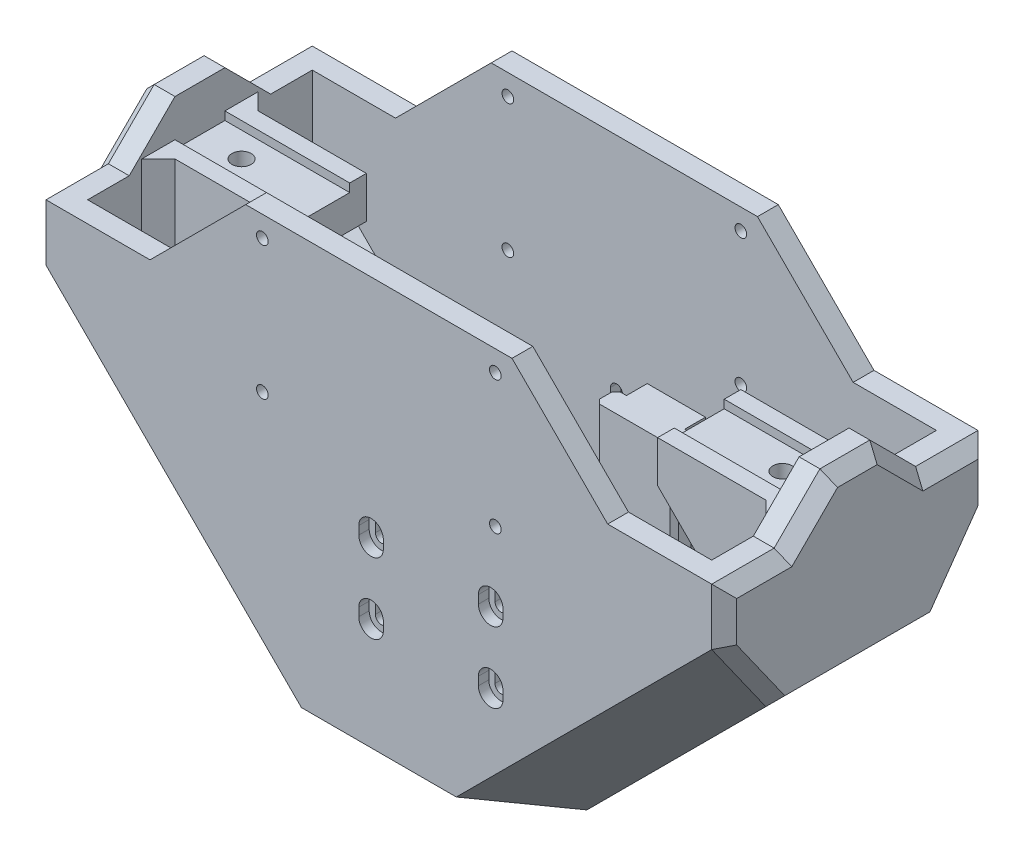
from build123d import *

# Parameters (mm, degrees)
SKETCH1_W                  = 150
SKETCH1_H                  = 54
BOSS_EXTRUDE1_DEPTH        = 70
SHELL1_T                   = 5
BOSS_EXTRUDE2_DEPTH        = 5
BOSS_EXTRUDE3_DEPTH        = 5
SKETCH3_R                  = 1.4
CUT_EXTRUDE1_DEPTH         = 6
BOSS_EXTRUDE4_DEPTH        = 10
SKETCH9_W                  = 30
SKETCH9_H                  = 20
BOSS_EXTRUDE6_DEPTH        = 2
CUT_EXTRUDE2_REACH         = 185.57
SKETCH10_W                 = 12
SKETCH10_H                 = 2
SKETCH11_R                 = 2.3
CUT_EXTRUDE3_DEPTH         = 6
CHAMFER3_SIZE              = 40
CHAMFER5_SIZE              = 43
CHAMFER11_SIZE             = 10
CHAMFER12_SIZE             = 13
CHAMFER13_SIZE             = 4
BOSS_EXTRUDE10_DEPTH       = 3
CHAMFER14_SIZE             = 3
CHAMFER14_OF_MIRROR28_SIZE = 3
SKETCH17_W                 = 14
SKETCH17_H                 = 5
BOSS_EXTRUDE11_DEPTH       = 45
SKETCH20_W                 = 19
SKETCH20_H                 = 5
BOSS_EXTRUDE14_DEPTH       = 8
CUT_EXTRUDE4_DEPTH         = 2.5
CUT_EXTRUDE5_REACH         = 140.997
CUT_EXTRUDE6_REACH         = 154.756
SKETCH24_W                 = 15
SKETCH24_H                 = 8
CHAMFER18_SIZE             = 4
CHAMFER19_SIZE             = 1
CHAMFER20_SIZE             = 2


# Some blends are built 0.0001 mm under size
with BuildPart() as part:
    # Sketch1 → Boss-Extrude1 (new body)
    with BuildSketch(Plane(origin=(0, 0, 0), x_dir=(1, 0, 0), z_dir=(0, 1, 0))):
        Rectangle(SKETCH1_W, SKETCH1_H)
    extrude(amount=BOSS_EXTRUDE1_DEPTH)

    # Shell1
    shell1_openings = [part.faces().sort_by_distance(p)[0] for p in [
        (0, 70, 0),
    ]]
    offset(amount=SHELL1_T, openings=shell1_openings, kind=Kind.INTERSECTION)

    # Sketch2 → Boss-Extrude2 (add)
    with BuildSketch(Plane(origin=(80, 0, 0), x_dir=(0, 0, -1), z_dir=(1, 0, 0))):
        Polygon((-17, 70), (-6, 81), (6, 81), (17, 70), align=None)
    boss_extrude2 = extrude(amount=-BOSS_EXTRUDE2_DEPTH)

    # Sketch4 → Boss-Extrude3 (add)
    with BuildSketch(Plane(origin=(0, 0, -32), x_dir=(-1, 0, 0), z_dir=(0, 0, -1))):
        Polygon((-55, 70), (-32, 93), (32, 93), (55, 70), align=None)
    boss_extrude3 = extrude(amount=-BOSS_EXTRUDE3_DEPTH)

    # Sketch3 → Cut-Extrude1 (cut)
    with BuildSketch(Plane(origin=(0, 0, -32), x_dir=(-1, 0, 0), z_dir=(0, 0, -1))):
        with Locations((-28, 88)):
            Circle(SKETCH3_R)
        with Locations((-28, 56)):
            Circle(SKETCH3_R)
        with Locations((28, 88)):
            Circle(SKETCH3_R)
        with Locations((28, 56)):
            Circle(SKETCH3_R)
    cut_extrude1 = extrude(amount=-CUT_EXTRUDE1_DEPTH, mode=Mode.SUBTRACT)

    # Mirror4: Boss-Extrude3, Cut-Extrude1 across plane
    add(boss_extrude3.mirror(Plane.XY))
    add(cut_extrude1.mirror(Plane.XY), mode=Mode.SUBTRACT)

    # Mirror5: Boss-Extrude2 across plane
    add(boss_extrude2.mirror(Plane(origin=(0, 0, 0), x_dir=(0, 0, 1), z_dir=(1, 0, 0))))

    # Sketch5 → Boss-Extrude4 (add, symmetric)
    with BuildSketch(Plane.XY):
        Polygon((-75, 70), (-45, 70), (-45, 62), (-75, 32), align=None)
    boss_extrude4 = extrude(amount=BOSS_EXTRUDE4_DEPTH, both=True)

    # Sketch9 → Boss-Extrude6 (add)
    with BuildSketch(Plane(origin=(0, 70, 0), x_dir=(1, 0, 0), z_dir=(0, 1, 0))):
        with Locations((-60, 0)):
            Rectangle(SKETCH9_W, SKETCH9_H)
    boss_extrude6 = extrude(amount=BOSS_EXTRUDE6_DEPTH)

    # Sketch10 → Cut-Extrude2 (cut, up to next)
    with BuildSketch(Plane(origin=(-75, 0, 0), x_dir=(0, 0, -1), z_dir=(1, 0, 0)), mode=Mode.PRIVATE) as cut_extrude2_sk1:
        with Locations((0, 71)):
            Rectangle(SKETCH10_W, SKETCH10_H)
    cut_extrude2_tool1 = extrude(cut_extrude2_sk1.sketch, amount=CUT_EXTRUDE2_REACH, mode=Mode.PRIVATE) & part.part
    cut_extrude2 = cut_extrude2_tool1.solids().sort_by_distance((-75, 71, 0))[0]
    add(cut_extrude2, mode=Mode.SUBTRACT)

    # Sketch11 → Cut-Extrude3 (cut)
    with BuildSketch(Plane(origin=(0, 70, 0), x_dir=(1, 0, 0), z_dir=(0, 1, 0))):
        with Locations(Location((-65, 0, 0), (0, 0, 270))):
            Circle(SKETCH11_R)
    cut_extrude3 = extrude(amount=-CUT_EXTRUDE3_DEPTH, mode=Mode.SUBTRACT)

    # Mirror24: Boss-Extrude4, Boss-Extrude6, Cut-Extrude2, Cut-Extrude3 across plane
    add(boss_extrude4.mirror(Plane(origin=(0, 0, 0), x_dir=(0, 0, 1), z_dir=(1, 0, 0))))
    add(boss_extrude6.mirror(Plane(origin=(0, 0, 0), x_dir=(0, 0, 1), z_dir=(1, 0, 0))))
    add(cut_extrude2.mirror(Plane(origin=(0, 0, 0), x_dir=(0, 0, 1), z_dir=(1, 0, 0))), mode=Mode.SUBTRACT)
    add(cut_extrude3.mirror(Plane(origin=(0, 0, 0), x_dir=(0, 0, 1), z_dir=(1, 0, 0))), mode=Mode.SUBTRACT)

    # Chamfer3
    # the kernel refuses this chamfer: 40 mm, written as the material it adds along each edge
    with BuildSketch(Plane(origin=(75, 0, 27), x_dir=(-0.9996219169112968, -0.027495876610586372, 0), z_dir=(0, 0, -1))) as chamfer3_piece_1:
        Polygon((CHAMFER3_SIZE * 0.999621916911, CHAMFER3_SIZE * 0.0274958766106), (-CHAMFER3_SIZE * 0.0274958766106, CHAMFER3_SIZE * 0.999621916911), (0, 0), align=None)
    extrude(amount=54)
    with BuildSketch(Plane(origin=(-75, 0, -27), x_dir=(-0.027495876610586317, 0.9996219169112968, 0), z_dir=(0, 0, 1))) as chamfer3_piece_2:
        Polygon((CHAMFER3_SIZE * 0.999621916911, -CHAMFER3_SIZE * 0.0274958766106), (-CHAMFER3_SIZE * 0.0274958766106, -CHAMFER3_SIZE * 0.999621916911), (0, 0), align=None)
    extrude(amount=54)

    # Chamfer5
    chamfer5_edges = [part.edges().sort_by_distance(p)[0] for p in [
        (-80, -5, 0),
        (80, -5, 0),
    ]]
    chamfer(chamfer5_edges, length=CHAMFER5_SIZE)

    # Chamfer11
    chamfer11_edges = [part.edges().sort_by_distance(p)[0] for p in [
        (-55, 20, -27),
        (55, 20, -27),
        (-55, 20, 27),
        (55, 20, 27),
    ]]
    chamfer(chamfer11_edges, length=CHAMFER11_SIZE)

    # Chamfer12
    chamfer12_edges = [part.edges().sort_by_distance(p)[0] for p in [
        (-58.5, 16.5, -32),
        (58.5, 16.5, -32),
        (-58.5, 16.5, 32),
        (58.5, 16.5, 32),
    ]]
    chamfer(chamfer12_edges, length=CHAMFER12_SIZE)

    # Chamfer13
    chamfer13_edges = [part.edges().sort_by_distance(p)[0] for p in [
        (-75, 56, -10),
        (-75, 56, 10),
        (75, 56, 10),
        (75, 56, -10),
    ]]
    chamfer(chamfer13_edges, length=CHAMFER13_SIZE)

    # Sketch16 → Boss-Extrude10 (add)
    with BuildSketch(Plane(origin=(80, 0, 0), x_dir=(0, 0, -1), z_dir=(1, 0, 0))):
        Polygon((-19, 38), (19, 38), (32, 56.384776311), (32, 70), (17, 70), (6, 81), (-6, 81), (-17, 70), (-32, 70), (-32, 56.384776311), align=None)
    boss_extrude10 = extrude(amount=BOSS_EXTRUDE10_DEPTH)

    # Chamfer14
    chamfer14_edges = [part.edges().sort_by_distance(p)[0] for p in [
        (83, 63.192388155, 32),
        (83, 70, 24.5),
        (83, 75.5, 11.5),
        (83, 81, 0),
        (83, 75.5, -11.5),
        (83, 70, -24.5),
        (83, 63.192388155, -32),
        (83, 47.192388155, -25.5),
        (83, 38, 0),
        (83, 47.192388155, 25.5),
    ]]
    chamfer(chamfer14_edges, length=CHAMFER14_SIZE - 0.0001)  # a hair under: the kernel refuses the full size

    # Mirror28: Boss-Extrude10 across plane
    add(boss_extrude10.mirror(Plane(origin=(0, 0, 0), x_dir=(0, 0, 1), z_dir=(1, 0, 0))))

    # Chamfer14 of Mirror28
    chamfer14_of_mirror28_edges = [part.edges().sort_by_distance(p)[0] for p in [
        (-83, 63.192388155, 32),
        (-83, 70, 24.5),
        (-83, 75.5, 11.5),
        (-83, 81, 0),
        (-83, 75.5, -11.5),
        (-83, 70, -24.5),
        (-83, 63.192388155, -32),
        (-83, 47.192388155, -25.5),
        (-83, 38, 0),
        (-83, 47.192388155, 25.5),
    ]]
    chamfer(chamfer14_of_mirror28_edges, length=CHAMFER14_OF_MIRROR28_SIZE - 0.0001)  # a hair under: the kernel refuses the full size

    # Sketch17 → Boss-Extrude11 (add)
    with BuildSketch(Plane(origin=(0, 0, 0), x_dir=(1, 0, 0), z_dir=(0, 1, 0))):
        Polygon((3, -22), (5.5, -22), (19.5, -22), (22, -22), (22, -17), (3, -17), align=None)
        with Locations((12.5, -24.5)):
            Rectangle(SKETCH17_W, SKETCH17_H)
    boss_extrude11 = extrude(amount=BOSS_EXTRUDE11_DEPTH)

    # Sketch20 → Boss-Extrude14 (add)
    with BuildSketch(Plane(origin=(0, 0, 0), x_dir=(1, 0, 0), z_dir=(0, 1, 0))):
        with Locations((12.5, -14.5)):
            Rectangle(SKETCH20_W, SKETCH20_H)
    boss_extrude14 = extrude(amount=BOSS_EXTRUDE14_DEPTH)

    # Mirror29: Boss-Extrude11, Boss-Extrude14 across plane
    add(boss_extrude11.mirror(Plane.XY))
    add(boss_extrude14.mirror(Plane.XY))

    # Sketch22 → Cut-Extrude4 (cut)
    with BuildSketch(Plane.XY.offset(-27)):
        with BuildLine():
            Line((-3.325, 37.8), (-3.325, 39.8))
            ThreePointArc((-3.325, 39.8), (-1.875, 41.25), (-0.425, 39.8))
            Line((-0.425, 39.8), (-0.425, 37.8))
            ThreePointArc((-0.425, 37.8), (-1.875, 36.35), (-3.325, 37.8))
        make_face()
        with BuildLine():
            Line((28.325, 37.8), (28.325, 39.8))
            ThreePointArc((28.325, 39.8), (26.875, 41.25), (25.425, 39.8))
            Line((25.425, 39.8), (25.425, 37.8))
            ThreePointArc((25.425, 37.8), (26.875, 36.35), (28.325, 37.8))
        make_face()
        with BuildLine():
            Line((-3.325, 22.8), (-3.325, 20.8))
            ThreePointArc((-3.325, 20.8), (-1.875, 19.35), (-0.425, 20.8))
            Line((-0.425, 20.8), (-0.425, 22.8))
            ThreePointArc((-0.425, 22.8), (-1.875, 24.25), (-3.325, 22.8))
        make_face()
        with BuildLine():
            Line((28.325, 22.8), (28.325, 20.8))
            ThreePointArc((28.325, 20.8), (26.875, 19.35), (25.425, 20.8))
            Line((25.425, 20.8), (25.425, 22.8))
            ThreePointArc((25.425, 22.8), (26.875, 24.25), (28.325, 22.8))
        make_face()
    cut_extrude4 = extrude(amount=-CUT_EXTRUDE4_DEPTH, mode=Mode.SUBTRACT)

    # Sketch23 → Cut-Extrude5 (cut, up to next)
    with BuildSketch(Plane.XY.offset(-29.5), mode=Mode.PRIVATE) as cut_extrude5_sk1:
        with BuildLine():
            Line((29.825, 37.8), (29.825, 39.8))
            ThreePointArc((29.825, 39.8), (26.875, 42.75), (23.925, 39.8))
            Line((23.925, 39.8), (23.925, 37.8))
            ThreePointArc((23.925, 37.8), (26.875, 34.85), (29.825, 37.8))
        make_face()
    cut_extrude5_tool1 = extrude(cut_extrude5_sk1.sketch, amount=-CUT_EXTRUDE5_REACH, mode=Mode.PRIVATE) & part.part
    # Sketch23 → Cut-Extrude5 (cut, up to next)
    with BuildSketch(Plane.XY.offset(-29.5), mode=Mode.PRIVATE) as cut_extrude5_sk2:
        with BuildLine():
            Line((1.075, 37.8), (1.075, 39.8))
            ThreePointArc((1.075, 39.8), (-1.875, 42.75), (-4.825, 39.8))
            Line((-4.825, 39.8), (-4.825, 37.8))
            ThreePointArc((-4.825, 37.8), (-1.875, 34.85), (1.075, 37.8))
        make_face()
    cut_extrude5_tool2 = extrude(cut_extrude5_sk2.sketch, amount=-CUT_EXTRUDE5_REACH, mode=Mode.PRIVATE) & part.part
    # Sketch23 → Cut-Extrude5 (cut, up to next)
    with BuildSketch(Plane.XY.offset(-29.5), mode=Mode.PRIVATE) as cut_extrude5_sk3:
        with BuildLine():
            Line((-4.825, 22.8), (-4.825, 20.8))
            ThreePointArc((-4.825, 20.8), (-1.875, 17.85), (1.075, 20.8))
            Line((1.075, 20.8), (1.075, 22.8))
            ThreePointArc((1.075, 22.8), (-1.875, 25.75), (-4.825, 22.8))
        make_face()
    cut_extrude5_tool3 = extrude(cut_extrude5_sk3.sketch, amount=-CUT_EXTRUDE5_REACH, mode=Mode.PRIVATE) & part.part
    # Sketch23 → Cut-Extrude5 (cut, up to next)
    with BuildSketch(Plane.XY.offset(-29.5), mode=Mode.PRIVATE) as cut_extrude5_sk4:
        with BuildLine():
            Line((23.925, 22.8), (23.925, 20.8))
            ThreePointArc((23.925, 20.8), (26.875, 17.85), (29.825, 20.8))
            Line((29.825, 20.8), (29.825, 22.8))
            ThreePointArc((29.825, 22.8), (26.875, 25.75), (23.925, 22.8))
        make_face()
    cut_extrude5_tool4 = extrude(cut_extrude5_sk4.sketch, amount=-CUT_EXTRUDE5_REACH, mode=Mode.PRIVATE) & part.part
    cut_extrude5_1 = cut_extrude5_tool1.solids().sort_by_distance((26.875, 38.8, -29.5))[0]
    add(cut_extrude5_1, mode=Mode.SUBTRACT)
    cut_extrude5_2 = cut_extrude5_tool2.solids().sort_by_distance((-1.875, 38.8, -29.5))[0]
    add(cut_extrude5_2, mode=Mode.SUBTRACT)
    cut_extrude5_3 = cut_extrude5_tool3.solids().sort_by_distance((-1.875, 21.8, -29.5))[0]
    add(cut_extrude5_3, mode=Mode.SUBTRACT)
    cut_extrude5_4 = cut_extrude5_tool4.solids().sort_by_distance((26.875, 21.8, -29.5))[0]
    add(cut_extrude5_4, mode=Mode.SUBTRACT)
    cut_extrude5 = cut_extrude5_1 + cut_extrude5_2 + cut_extrude5_3 + cut_extrude5_4  # Cut-Extrude5 as one shape, for the pattern or mirror that repeats it

    # Mirror30: Cut-Extrude4, Cut-Extrude5 across plane
    add(cut_extrude4.mirror(Plane.XY), mode=Mode.SUBTRACT)
    add(cut_extrude5.mirror(Plane.XY), mode=Mode.SUBTRACT)

    # Sketch24 → Cut-Extrude6 (cut, up to next)
    with BuildSketch(Plane(origin=(17.5, -17.5, 0), x_dir=(0, 0, 1), z_dir=(-0.707106781186544, 0.7071067811865511, 0)), mode=Mode.PRIVATE) as cut_extrude6_sk1:
        with Locations((0, 33.748737342)):
            Rectangle(SKETCH24_W, SKETCH24_H)
    cut_extrude6_tool1 = extrude(cut_extrude6_sk1.sketch, amount=-CUT_EXTRUDE6_REACH, mode=Mode.PRIVATE) & part.part
    add(cut_extrude6_tool1.solids().sort_by_distance((41.363961, 6.363961, 0))[0], mode=Mode.SUBTRACT)

    # Chamfer18
    chamfer18_edges = [part.edges().sort_by_distance(p)[0] for p in [
        (22, 0, 17),
        (3, 0, 17),
        (3, 0, -17),
        (22, 0, -17),
    ]]
    chamfer(chamfer18_edges, length=CHAMFER18_SIZE)

    # Chamfer19
    chamfer19_edges = [part.edges().sort_by_distance(p)[0] for p in [
        (3, 24.5, 22),
        (22, 24.5, 22),
        (22, 26.5, 17),
        (3, 26.5, 17),
        (3, 24.5, -22),
        (3, 26.5, -17),
        (22, 26.5, -17),
        (22, 24.5, -22),
    ]]
    chamfer(chamfer19_edges, length=CHAMFER19_SIZE)

    # Chamfer20
    chamfer20_edges = [part.edges().sort_by_distance(p)[0] for p in [
        (45.942388155, 7.442388155, 7.5),
        (40.285533906, 1.785533906, 7.5),
        (40.285533906, 1.785533906, -7.5),
        (45.942388155, 7.442388155, -7.5),
    ]]
    chamfer(chamfer20_edges, length=CHAMFER20_SIZE)


solid = part.part
